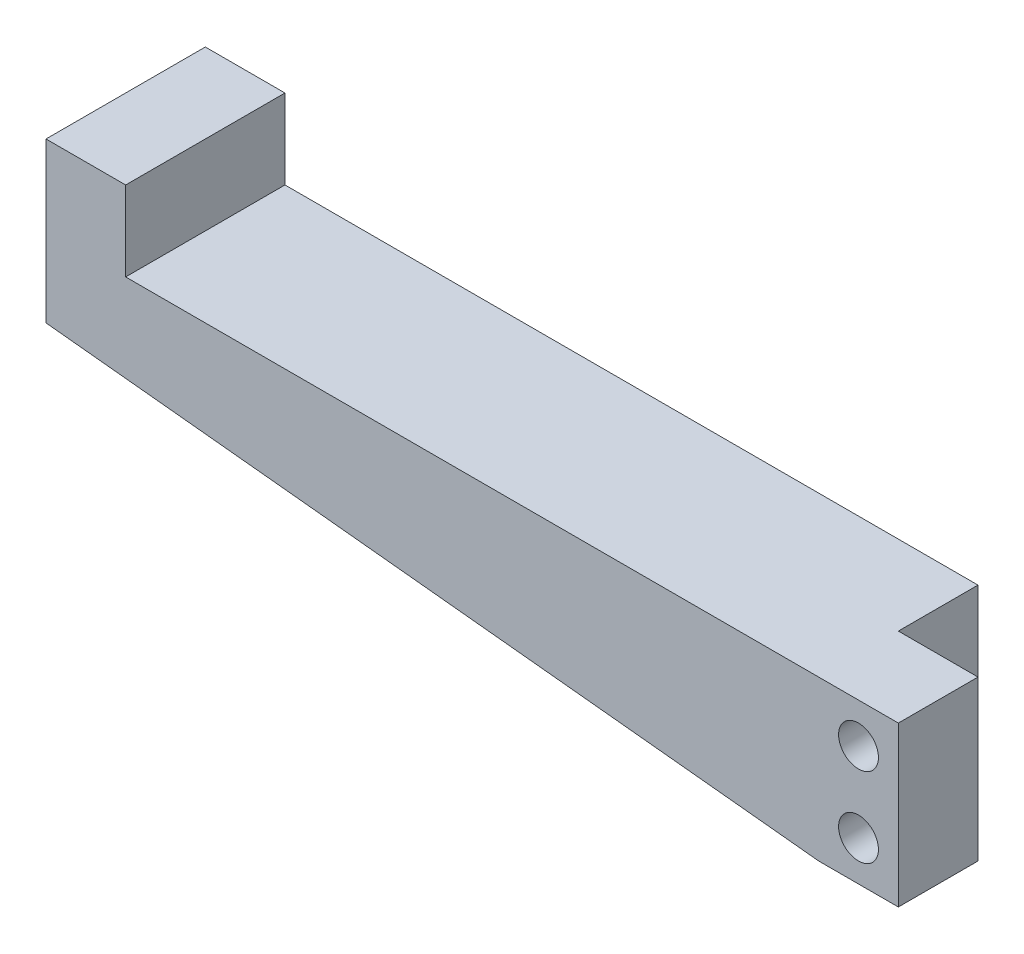
from build123d import *

# Parameters (mm, degrees)
ESQUISSE1_R             = 2.5
BOSS_EXTRU_1_DEPTH      = 20
ESQUISSE3_W             = 10
ESQUISSE3_H             = 20
ENL_V_MAT_EXTRU_2_DEPTH = 10


with BuildPart() as part:
    # Esquisse1 → Boss.-Extru.1 (new body)
    with BuildSketch(Plane.XY):
        Polygon((-102, 0), (-5, -10), (5, -10), (5, 10), (-5, 10), (-92, 10), (-92, 20), (-102, 20), (-102, 10), align=None)
        with Locations((0, 5)):
            Circle(ESQUISSE1_R, mode=Mode.SUBTRACT)
        with Locations((0, -5)):
            Circle(ESQUISSE1_R, mode=Mode.SUBTRACT)
    extrude(amount=BOSS_EXTRU_1_DEPTH)

    # Esquisse3 → Enlèv. mat.-Extru.2 (cut)
    with BuildSketch(Plane(origin=(0, 0, 0), x_dir=(-1, 0, 0), z_dir=(0, 0, -1))):
        Rectangle(ESQUISSE3_W, ESQUISSE3_H)
    extrude(amount=-ENL_V_MAT_EXTRU_2_DEPTH, mode=Mode.SUBTRACT)


solid = part.part
